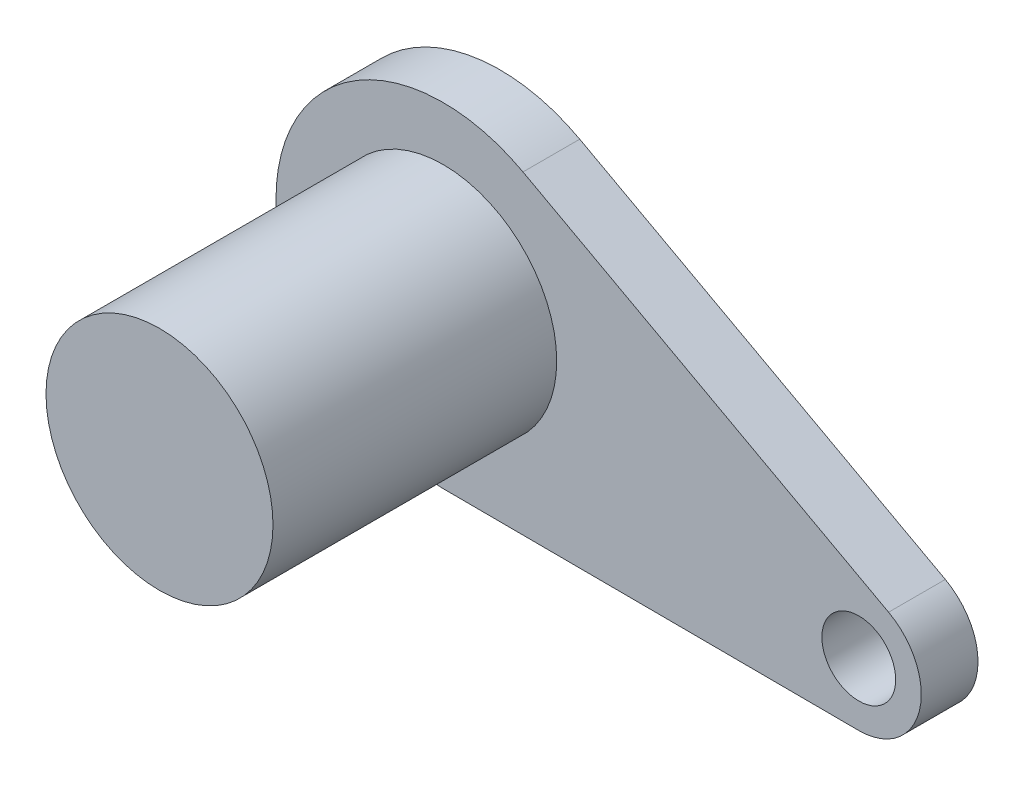
from build123d import *

# Parameters (mm, degrees)
SKETCH1_R               = 2
BOSS_EXTRUDE1_DEPTH     = 5
BOSS_EXTRUDE2_DEPTH     = 1
CUT_EXTRUDE1_DEPTH      = 56.072597377
CUT_EXTRUDE1_DEPTH_BACK = 56.072597377
SKETCH3_R               = 0.65


with BuildPart() as part:
    # Sketch1 → Boss-Extrude1 (new body)
    with BuildSketch(Plane.XY):
        with Locations((30.458296942, 35.732918139)):
            Circle(SKETCH1_R)
    extrude(amount=-BOSS_EXTRUDE1_DEPTH)

    # Sketch2 → Boss-Extrude2 (add)
    with BuildSketch(Plane(origin=(0, 0, -5), x_dir=(-1, 0, 0), z_dir=(0, 0, -1))):
        with BuildLine():
            ThreePointArc((-38.30710157, 34.824835399), (-38.848941129, 33.586198742), (-37.781773498, 32.756160115))
            Line((-37.781773498, 32.756160115), (-30.446238276, 32.786178641))
            ThreePointArc((-30.446238276, 32.786178641), (-27.603676035, 36.464053256), (-31.864257159, 38.32264688))
            Line((-31.864257159, 38.32264688), (-38.30710157, 34.824835399))
        make_face()
    extrude(amount=BOSS_EXTRUDE2_DEPTH)

    # Sketch3 → Cut-Extrude1 (cut, two sides: drawn at the far end of the back side and taken through both)
    with BuildSketch(Plane.XY.offset(-5).offset(-CUT_EXTRUDE1_DEPTH_BACK)):
        with Locations((37.781773498, 33.857199764)):
            Circle(SKETCH3_R)
    extrude(amount=CUT_EXTRUDE1_DEPTH + CUT_EXTRUDE1_DEPTH_BACK, mode=Mode.SUBTRACT)


solid = part.part
